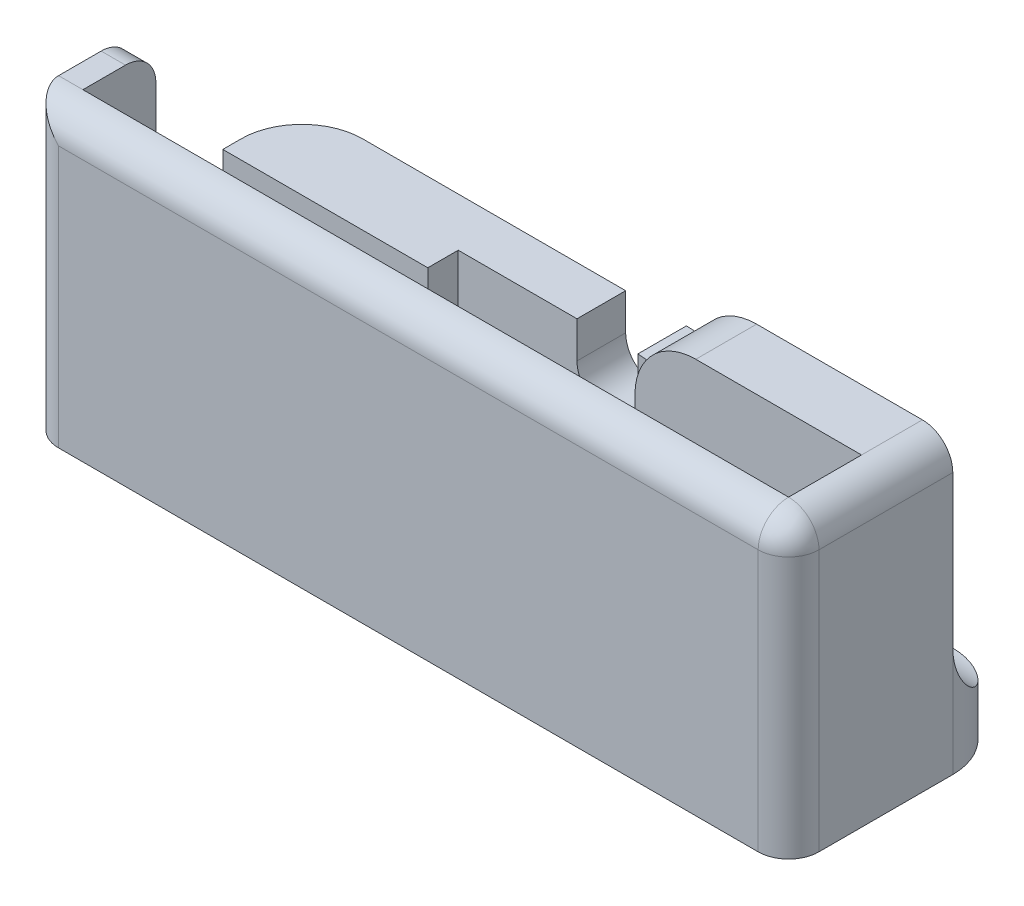
from build123d import *

# Parameters (mm, degrees)
SKETCH1_W           = 79.375
SKETCH1_H           = 23.495
BOSS_EXTRUDE1_DEPTH = 5.08
SKETCH2_W           = 79.375
SKETCH2_H           = 3.175
BOSS_EXTRUDE2_DEPTH = 25.4
SKETCH3_W           = 52.546018004
SKETCH3_H           = 5.08
BOSS_EXTRUDE3_DEPTH = 5.08
BOSS_EXTRUDE4_DEPTH = 10.16
CUT_EXTRUDE1_REACH  = 91.699
CUT_EXTRUDE2_REACH  = 91.699
FILLET2_R           = 6.35
FILLET3_R           = 6.35
FILLET4_R           = 6.35
FILLET5_R           = 6.35
BOSS_EXTRUDE6_DEPTH = 2.54
BOSS_EXTRUDE7_DEPTH = 25.4
FILLET6_R           = 6.35
FILLET7_START       = 52.546018004
FILLET7_DEPTH       = 26.828981996
FILLET7_START_2     = 5.08
FILLET7_2_DEPTH     = 6.92
FILLET8_START       = -18
FILLET8_DEPTH       = 19
FILLET9_R           = 3.175


with BuildPart() as part:
    # Sketch1 → Boss-Extrude1 (new body)
    with BuildSketch(Plane(origin=(0, 0, 0), x_dir=(1, 0, 0), z_dir=(0, 1, 0))):
        with Locations((39.6875, 11.7475)):
            Rectangle(SKETCH1_W, SKETCH1_H)
    extrude(amount=BOSS_EXTRUDE1_DEPTH)

    # Sketch2 → Boss-Extrude2 (add)
    with BuildSketch(Plane(origin=(0, 5.08, 0), x_dir=(1, 0, 0), z_dir=(0, 1, 0))):
        with Locations((39.6875, 1.5875)):
            Rectangle(SKETCH2_W, SKETCH2_H)
    extrude(amount=BOSS_EXTRUDE2_DEPTH)

    # Sketch3 → Boss-Extrude3 (add)
    with BuildSketch(Plane(origin=(0, 0, -23.495), x_dir=(-1, 0, 0), z_dir=(0, 0, -1))):
        with Locations((-26.273009002, 2.54)):
            Rectangle(SKETCH3_W, SKETCH3_H)
    extrude(amount=BOSS_EXTRUDE3_DEPTH)

    # Sketch4 → Boss-Extrude4 (add)
    with BuildSketch(Plane(origin=(0, 5.08, 0), x_dir=(1, 0, 0), z_dir=(0, 1, 0))):
        Polygon((46.196018004, 28.575), (0, 28.575), (0, 10.795), (21.397643113, 10.795), (21.397643113, 23.495), (46.196018004, 23.495), align=None)
    extrude(amount=BOSS_EXTRUDE4_DEPTH)

    # Sketch7 → Cut-Extrude1 (cut, up to next)
    with BuildSketch(Plane(origin=(0, 0, -28.575), x_dir=(-1, 0, 0), z_dir=(0, 0, -1)), mode=Mode.PRIVATE) as cut_extrude1_sk1:
        with BuildLine():
            Line((-40.146830558, 11.43), (-40.146830558, 15.24))
            Line((-40.146830558, 15.24), (-33.796830558, 15.24))
            Line((-33.796830558, 15.24), (-33.796830558, 11.43))
            ThreePointArc((-33.796830558, 11.43), (-36.971830558, 8.255), (-40.146830558, 11.43))
        make_face()
    cut_extrude1_tool1 = extrude(cut_extrude1_sk1.sketch, amount=-CUT_EXTRUDE1_REACH, mode=Mode.PRIVATE) & part.part
    add(cut_extrude1_tool1.solids().sort_by_distance((36.971831, 12.048348, -28.575))[0], mode=Mode.SUBTRACT)

    # Sketch8 → Cut-Extrude2 (cut, up to next)
    with BuildSketch(Plane.ZY, mode=Mode.PRIVATE) as cut_extrude2_sk1:
        with BuildLine():
            Line((-13.97, 11.43), (-13.97, 15.24))
            Line((-13.97, 15.24), (-20.32, 15.24))
            Line((-20.32, 15.24), (-20.32, 11.43))
            ThreePointArc((-20.32, 11.43), (-17.145, 8.255), (-13.97, 11.43))
        make_face()
    cut_extrude2_tool1 = extrude(cut_extrude2_sk1.sketch, amount=-CUT_EXTRUDE2_REACH, mode=Mode.PRIVATE) & part.part
    add(cut_extrude2_tool1.solids().sort_by_distance((0, 12.048348, -17.145))[0], mode=Mode.SUBTRACT)

    # Fillet2
    # the kernel refuses this fillet: 6.35 mm, written as the material it adds along each edge
    with BuildSketch(Plane(origin=(52.546018004, 5.08, -23.495), x_dir=(1, 0, 0), z_dir=(0, -1, 0))) as fillet2_piece_1:
        with BuildLine():
            CenterArc((6.221703947, -6.35), FILLET2_R, 90, 78.463040967)
            Line((0, -5.08), (0, 0))
            Line((0, 0), (6.221703947, 0))
        make_face()
    extrude(amount=5.08)
    # the kernel refuses this fillet: 6.35 mm, written as the material it takes off along each edge
    with BuildSketch(Plane(origin=(0, 31.115, -28.575), x_dir=(0, 0, 1), z_dir=(0, -1, 0))) as fillet2_2_piece_1:
        with BuildLine():
            CenterArc((FILLET2_R, -FILLET2_R), FILLET2_R, 90, 90)
            Line((0, -FILLET2_R), (0, 0))
            Line((0, 0), (FILLET2_R, 0))
        make_face()
    extrude(amount=46.99, mode=Mode.SUBTRACT)
    with BuildSketch(Plane(origin=(79.375, -15.875, -23.495), x_dir=(0, 0, 1), z_dir=(0, 1, 0))) as fillet2_2_piece_2:
        with BuildLine():
            CenterArc((FILLET2_R, -FILLET2_R), FILLET2_R, 90, 90)
            Line((0, -FILLET2_R), (0, 0))
            Line((0, 0), (FILLET2_R, 0))
        make_face()
    extrude(amount=36.83, mode=Mode.SUBTRACT)

    # Fillet3
    fillet3_edges = [part.edges().sort_by_distance(p)[0] for p in [
        (52.546018004, 2.54, -28.575),
    ]]
    fillet(fillet3_edges, radius=FILLET3_R)

    # Fillet4
    fillet4_edges = [part.edges().sort_by_distance(p)[0] for p in [
        (46.196018004, 5.08, -26.035),
    ]]
    fillet(fillet4_edges, radius=FILLET4_R)

    # Fillet5
    # the kernel refuses this fillet: 6.35 mm, written as the material it takes off along each edge
    with BuildSketch(Plane(origin=(46.196018004, 15.24, -8.261480267), x_dir=(-1, 0, 0), z_dir=(0, 0, -1))) as fillet5_piece_1:
        with BuildLine():
            CenterArc((6.093407893, -6.35), FILLET5_R, 90, 78.463040967)
            Line((-0.128296053, -5.08), (-0.750466448, -4.953))
            ThreePointArc((-0.750466448, -4.953), (-0.635, -3.81), (-0.635, 0))
            Line((-0.635, 0), (0, 0.635))
            Line((0, 0.635), (6.093407893, 0.635))
            Line((6.093407893, 0.635), (6.093407893, 0))
        make_face()
    extrude(amount=35.547039467, mode=Mode.SUBTRACT)

    # Sketch10 → Boss-Extrude6 (add)
    with BuildSketch(Plane.ZY):
        with BuildLine():
            Line((-3.175, 5.08), (-10.795, 5.08))
            Line((-10.795, 5.08), (-10.795, 15.24))
            Line((-10.795, 15.24), (-13.97, 15.24))
            ThreePointArc((-13.97, 15.24), (-11.72493597, 16.16993597), (-10.795, 18.415))
            Line((-10.795, 18.415), (-10.795, 27.305))
            ThreePointArc((-10.795, 27.305), (-9.86506403, 29.55006403), (-7.62, 30.48))
            Line((-7.62, 30.48), (-3.175, 30.48))
            Line((-3.175, 30.48), (-3.175, 5.08))
        make_face()
    extrude(amount=-BOSS_EXTRUDE6_DEPTH)

    # Sketch11 → Boss-Extrude7 (add)
    with BuildSketch(Plane(origin=(0, 5.08, 0), x_dir=(1, 0, 0), z_dir=(0, 1, 0))):
        Polygon((79.375, 3.175), (79.375, 17.145), (52.546018004, 17.145), (52.546018004, 10.795), (76.2, 10.795), (76.2, 3.175), align=None)
    extrude(amount=BOSS_EXTRUDE7_DEPTH)

    # Fillet6
    fillet6_edges = [part.edges().sort_by_distance(p)[0] for p in [
        (52.546018004, 30.48, -13.97),
    ]]
    fillet(fillet6_edges, radius=FILLET6_R)

    # Fillet7: read off the stored shape, not the designer's step
    # Fillet7 outline → Fillet7 (add)
    with BuildSketch(Plane.YZ.offset(FILLET7_START)):
        with BuildLine():
            ThreePointArc((5.08, -23.495), (6.939871939, -19.004871939), (11.43, -17.145))
            Line((11.43, -17.145), (5.08, -17.145))
            Line((5.08, -17.145), (5.08, -23.495))
        make_face()
    extrude(amount=FILLET7_DEPTH)

    # Fillet7 2 outline → Fillet7 2 (cut)
    with BuildSketch(Plane(origin=(0, 0, 0), x_dir=(1, 0, 0), z_dir=(0, 1, 0)).offset(FILLET7_START_2)):
        with BuildLine():
            Line((72, 23.495), (73.025, 23.495))
            ThreePointArc((73.025, 23.495), (77.515129122, 21.635126999), (79.375, 17.144996999))
            Line((79.375, 17.144996999), (79.374999459, 16))
            Line((79.374999459, 16), (81, 16))
            Line((81, 16), (81, 25))
            Line((81, 25), (72, 25))
            Line((72, 25), (72, 23.495))
        make_face()
    extrude(amount=FILLET7_2_DEPTH, mode=Mode.SUBTRACT)

    # Fillet8: read off the stored shape, not the designer's step
    # Fillet8 outline → Fillet8 (cut)
    with BuildSketch(Plane.XY.offset(FILLET8_START)):
        with BuildLine():
            Line((79.375, 30.48), (76.2, 30.48))
            ThreePointArc((76.2, 30.48), (78.44506403, 29.55006403), (79.375, 27.305))
            Line((79.375, 27.305), (79.375, 30.48))
        make_face()
    extrude(amount=FILLET8_DEPTH, mode=Mode.SUBTRACT)

    # Fillet9
    fillet9_edges = [part.edges().sort_by_distance(p)[0] for p in [
        (38.1, 30.48, 0),
        (79.375, 13.6525, 0),
        (0, 15.24, 0),
        (78.44506403, 29.55006403, 0),
    ]]
    fillet(fillet9_edges, radius=FILLET9_R - 0.0001)  # a hair under: the kernel refuses the full size


solid = part.part
